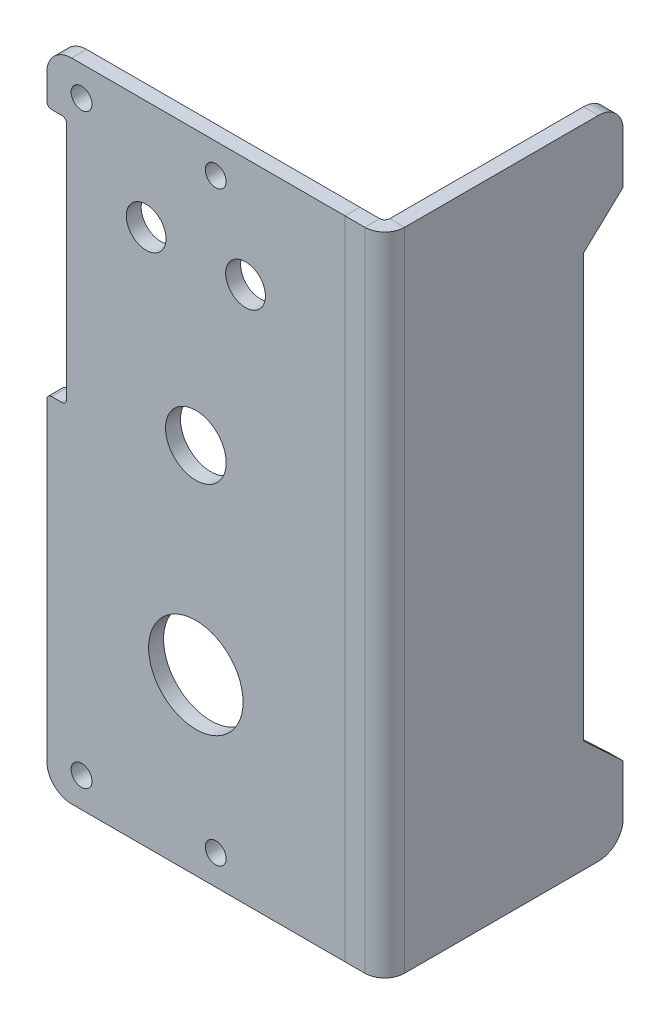
from build123d import *

# Parameters (mm, degrees)
SKETCH1_W              = 60
SKETCH1_H              = 130
BOSS_EXTRUDE1_DEPTH    = 3
SKETCH2_R              = 2.1
CUT_EXTRUDE1_DEPTH     = 72.651936471
LPATTERN1_COUNT        = 2
LPATTERN1_PITCH        = 27
LPATTERN1_COUNT_DIR2   = 2
LPATTERN1_PITCH_DIR2   = 118
SKETCH3_R              = 9.5
CUT_EXTRUDE2_DEPTH     = 72.651936471
SKETCH_1_R             = 6.1
CUT_EXTRUDE_1_DEPTH    = 72.651936471
SKETCH_2_R             = 4
CUT_EXTRUDE_2_DEPTH    = 72.651936471
FILLET_1_R             = 5
SM_BASE_FLANGE_1_DEPTH = 130
FILLET_2_R             = 5
CUT_EXTRUDE_3_DEPTH    = 105.27847333
SKETCH_9_W             = 4
SKETCH_9_H             = 50
CUT_EXTRUDE_4_DEPTH    = 90.291656945
FILLET_3_R             = 1


# Sheet-metal steps are written as plain solids
with BuildPart() as part:
    # Sketch1 → Boss-Extrude1 (new body)
    with BuildSketch(Plane.XY):
        Rectangle(SKETCH1_W, SKETCH1_H)
    extrude(amount=BOSS_EXTRUDE1_DEPTH)

    # Sketch2 → Cut-Extrude1 (cut, through all)
    with BuildSketch(Plane.XY.offset(3)):
        with Locations((-23, 59)):
            Circle(SKETCH2_R)
    cut_extrude1 = extrude(amount=-CUT_EXTRUDE1_DEPTH, mode=Mode.SUBTRACT)

    # LPattern1: Cut-Extrude1 2 × 2
    with Locations(*[(i * LPATTERN1_PITCH, -j * LPATTERN1_PITCH_DIR2, 0) for i in range(LPATTERN1_COUNT) for j in range(LPATTERN1_COUNT_DIR2) if (i, j) != (0, 0)]):
        add(cut_extrude1, mode=Mode.SUBTRACT)

    # Sketch3 → Cut-Extrude2 (cut, through all)
    with BuildSketch(Plane.XY.offset(3)):
        with Locations((0, -30)):
            Circle(SKETCH3_R)
    extrude(amount=-CUT_EXTRUDE2_DEPTH, mode=Mode.SUBTRACT)

    # 草圖1 → 除料-伸長1 (cut, through all)
    with BuildSketch(Plane.XY.offset(3)):
        with Locations((0, 10)):
            Circle(SKETCH_1_R)
    extrude(amount=-CUT_EXTRUDE_1_DEPTH, mode=Mode.SUBTRACT)

    # 草圖2 → 除料-伸長2 (cut, through all)
    with BuildSketch(Plane.XY.offset(3)):
        with Locations((-10, 43)):
            Circle(SKETCH_2_R)
        with Locations((10, 43)):
            Circle(SKETCH_2_R)
    extrude(amount=-CUT_EXTRUDE_2_DEPTH, mode=Mode.SUBTRACT)

    # 圓角1
    fillet_1_edges = [part.edges().sort_by_distance(p)[0] for p in [
        (-30, -65, 1.5),
        (-30, 65, 1.5),
    ]]
    fillet(fillet_1_edges, radius=FILLET_1_R)

    # 草圖9 → 除料-伸長4 (cut, through all)
    with BuildSketch(Plane.XY.offset(3)):
        with Locations((-28, 29)):
            Rectangle(SKETCH_9_W, SKETCH_9_H)
    extrude(amount=-CUT_EXTRUDE_4_DEPTH, mode=Mode.SUBTRACT)

    # 圓角3
    fillet_3_edges = [part.edges().sort_by_distance(p)[0] for p in [
        (-30, 4, 1.5),
        (-30, 54, 1.5),
        (-26, 54, 1.5),
        (-26, 4, 1.5),
    ]]
    fillet(fillet_3_edges, radius=FILLET_3_R)


with BuildPart() as body_2:
    # 草圖3 → 基材-凸緣1 (new body)
    with BuildSketch(Plane(origin=(30, 65, 0), x_dir=(1, 0, 0), z_dir=(0, 1, 0))):
        with BuildLine():
            Line((0, 0), (4, 0))
            ThreePointArc((4, 0), (4.707106781, 0.292893219), (5, 1))
            Line((5, 1), (5, 45))
            Line((5, 45), (8, 45))
            Line((8, 45), (8, 1))
            ThreePointArc((8, 1), (6.828427125, -1.828427125), (4, -3))
            Line((4, -3), (0, -3))
            Line((0, -3), (0, 0))
        make_face()
    extrude(amount=-SM_BASE_FLANGE_1_DEPTH)

    # 圓角2
    fillet_2_edges = [body_2.edges().sort_by_distance(p)[0] for p in [
        (36.5, -65, -45),
        (36.5, 65, -45),
    ]]
    fillet(fillet_2_edges, radius=FILLET_2_R)

    # 草圖8 → 除料-伸長3 (cut, through all)
    with BuildSketch(Plane(origin=(38, 0, 0), x_dir=(0, 0, -1), z_dir=(1, 0, 0))):
        Polygon((45, 50), (37, 42.5), (37, -42.5), (45, -50), align=None)
    extrude(amount=-CUT_EXTRUDE_3_DEPTH, mode=Mode.SUBTRACT)


solid = Compound([part.part, body_2.part])
